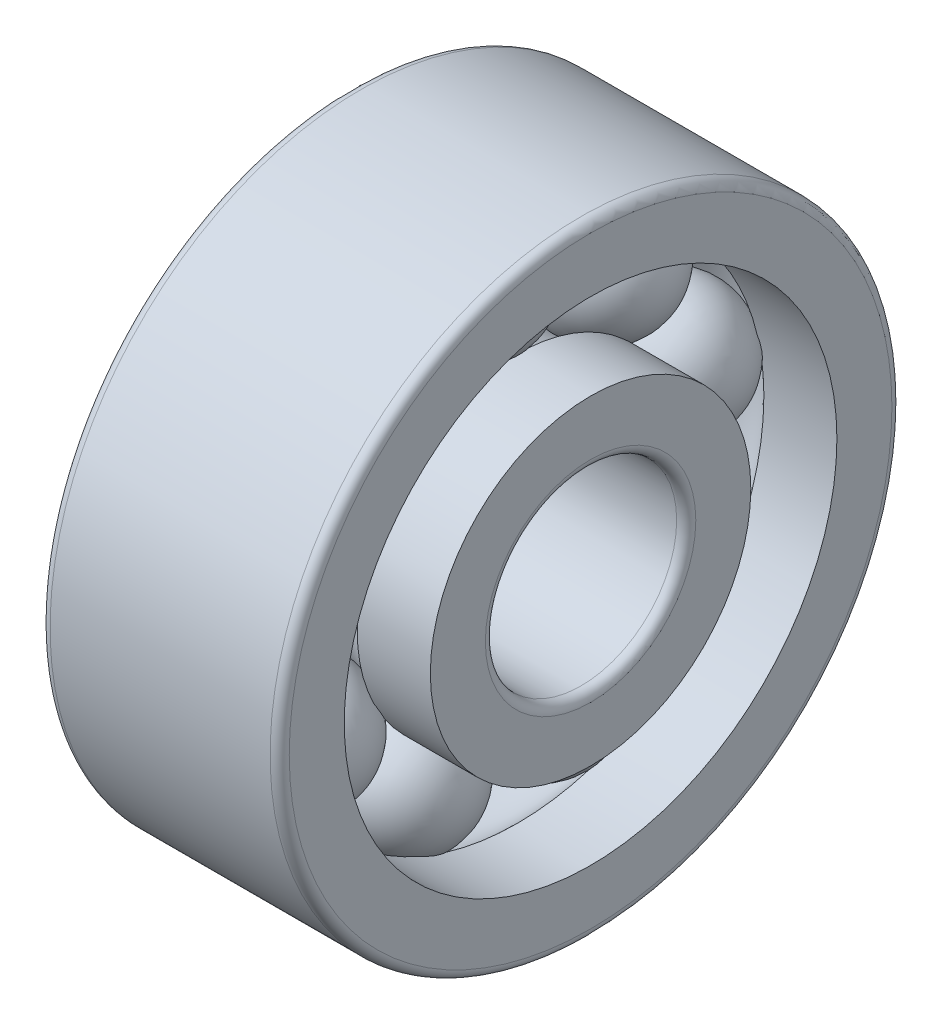
from build123d import *

# Parameters (mm, degrees)
CAGSPISKE_W         = 0.27
CAGSPISKE_H         = 0.45
CAGESPINE_ANGLE     = 0.001
BALLSDETAILED_COUNT = 9
BALLSDETAILED_ANGLE = 320


with BuildPart() as part:
    # CagSpiSke → CageSpine (revolve)
    with BuildSketch(Plane.XY):
        with Locations((0, 4.25)):
            Rectangle(CAGSPISKE_W, CAGSPISKE_H)
    revolve(axis=Axis((-20.6375, 0, 0), (1, 0, 0)), revolution_arc=CAGESPINE_ANGLE)

    # BalDetSke → BallDetailed (revolve)
    with BuildSketch(Plane.XY):
        with BuildLine():
            Line((-1.35, 4.25), (1.35, 4.25))
            ThreePointArc((1.35, 4.25), (0, 2.9), (-1.35, 4.25))
        make_face()
    balldetailed = revolve(axis=Axis((-1.905, 4.25, 0), (1, 0, 0)))

    # InnRacSke → InnerRace (revolve)
    with BuildSketch(Plane.XY):
        with BuildLine():
            Line((-0.972432517, 3.35), (-2.5, 3.35))
            Line((-2.5, 3.35), (-2.5, 2.2))
            ThreePointArc((-2.5, 2.2), (-2.441421356, 2.058578644), (-2.3, 2))
            Line((-2.3, 2), (2.3, 2))
            ThreePointArc((2.3, 2), (2.441421356, 2.058578644), (2.5, 2.2))
            Line((2.5, 2.2), (2.5, 3.35))
            Line((2.5, 3.35), (0.972432517, 3.35))
            ThreePointArc((0.972432517, 3.35), (0, 2.925), (-0.972432517, 3.35))
        make_face()
    revolve(axis=Axis((-20.6375, 0, 0), (1, 0, 0)))

    # OutRacSke → OuterRace (revolve)
    with BuildSketch(Plane.XY):
        with BuildLine():
            Line((-0.972432517, 5.15), (-2.5, 5.15))
            Line((-2.5, 5.15), (-2.5, 6.3))
            ThreePointArc((-2.5, 6.3), (-2.441421356, 6.441421356), (-2.3, 6.5))
            Line((-2.3, 6.5), (2.3, 6.5))
            ThreePointArc((2.3, 6.5), (2.441421356, 6.441421356), (2.5, 6.3))
            Line((2.5, 6.3), (2.5, 5.15))
            Line((2.5, 5.15), (0.972432517, 5.15))
            ThreePointArc((0.972432517, 5.15), (0, 5.575), (-0.972432517, 5.15))
        make_face()
    revolve(axis=Axis((-20.6375, 0, 0), (1, 0, 0)))

    # BallsDetailed: BallDetailed ×9 about axis
    ballsdetailed_axis = Axis((-50, 0, 0), (1, 0, 0))
    for i in range(1, BALLSDETAILED_COUNT):
        add(balldetailed.rotate(ballsdetailed_axis, i * BALLSDETAILED_ANGLE / (BALLSDETAILED_COUNT - 1)))


solid = part.part
